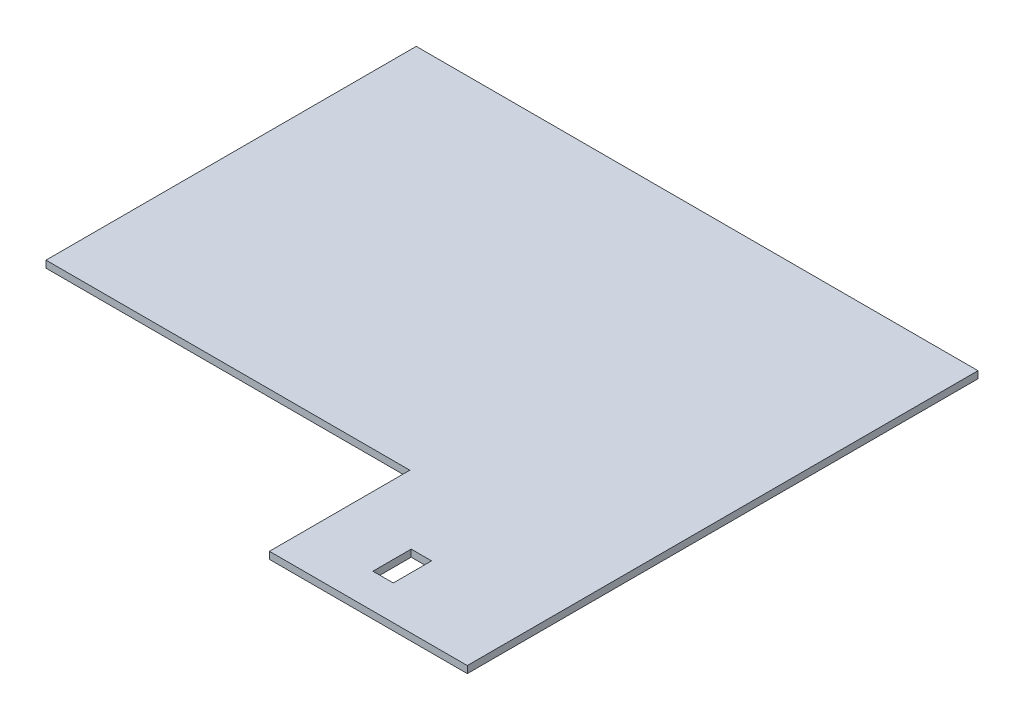
from build123d import *

# Parameters (mm, degrees)
CROQUIS1_W              = 15.961432879
CROQUIS1_H              = 30
SALIENTE_EXTRUIR1_DEPTH = 5.5


with BuildPart() as part:
    # Croquis1 → Saliente-Extruir1 (new body)
    with BuildSketch(Plane(origin=(0, 0, 0), x_dir=(-1, 0, 0), z_dir=(0, 1, 0))):
        Polygon((-73.586706802, 402.295789036), (-143.586706802, 402.295789036), (-228.586706802, 402.295789036), (-228.586706802, 2.295789036), (211.413293198, 2.295789036), (211.413293198, 292.295789036), (-73.586706802, 292.295789036), align=None)
        with Locations((-135.605990362, 360.295789036)):
            Rectangle(CROQUIS1_W, CROQUIS1_H, mode=Mode.SUBTRACT)
    extrude(amount=SALIENTE_EXTRUIR1_DEPTH)


solid = part.part
